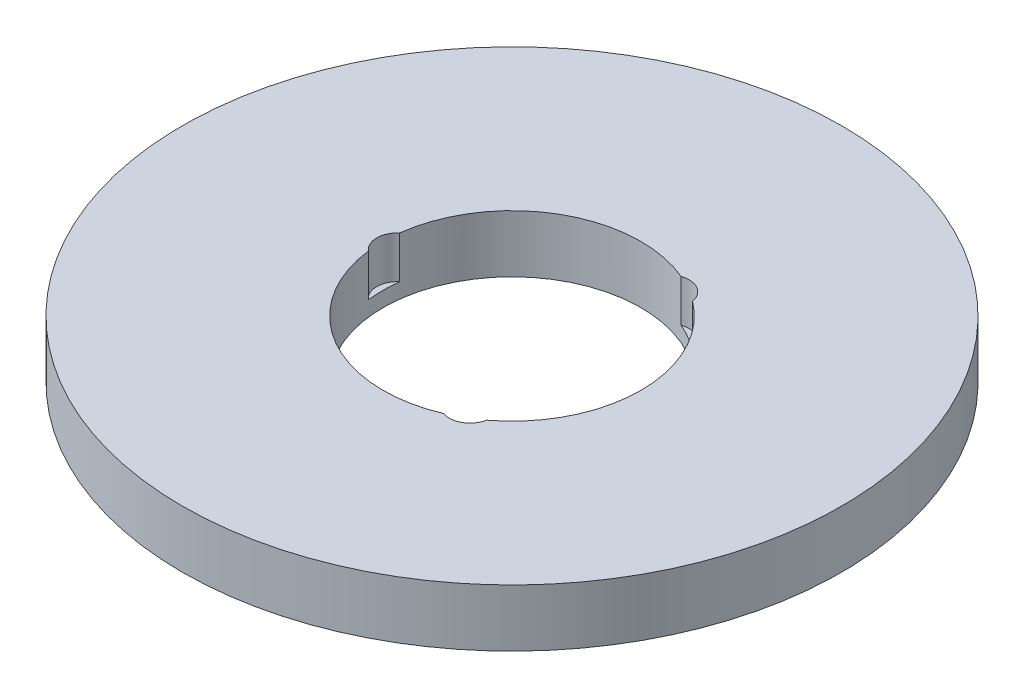
from build123d import *

# Parameters (mm, degrees)
SKETCH1_R           = 57.5
BOSS_EXTRUDE1_DEPTH = 10
SKETCH2_R           = 22.5
CUT_EXTRUDE1_DEPTH  = 82.929848041
SKETCH3_R           = 3.59659005
CUT_EXTRUDE2_DEPTH  = 7.371392203
CIRPATTERN1_COUNT   = 3


with BuildPart() as part:
    # Sketch1 → Boss-Extrude1 (new body)
    with BuildSketch(Plane(origin=(0, 0, 0), x_dir=(1, 0, 0), z_dir=(0, 1, 0))):
        Circle(SKETCH1_R)
    extrude(amount=BOSS_EXTRUDE1_DEPTH)

    # Sketch2 → Cut-Extrude1 (cut, through all)
    with BuildSketch(Plane(origin=(0, 0, 0), x_dir=(1, 0, 0), z_dir=(0, 1, 0))):
        Circle(SKETCH2_R)
    extrude(amount=CUT_EXTRUDE1_DEPTH, mode=Mode.SUBTRACT)

    # Sketch3 → Cut-Extrude2 (cut)
    with BuildSketch(Plane(origin=(0, 10, 0), x_dir=(1, 0, 0), z_dir=(0, 1, 0))):
        with Locations((-20.00094245, 0)):
            Circle(SKETCH3_R)
    cut_extrude2 = extrude(amount=-CUT_EXTRUDE2_DEPTH, mode=Mode.SUBTRACT)

    # CirPattern1: Cut-Extrude2 ×3 about axis
    cirpattern1_axis = Axis((0, 0, 0), (0, 1, 0))
    for i in range(1, CIRPATTERN1_COUNT):
        add(cut_extrude2.rotate(cirpattern1_axis, i * 360 / CIRPATTERN1_COUNT), mode=Mode.SUBTRACT)


solid = part.part
